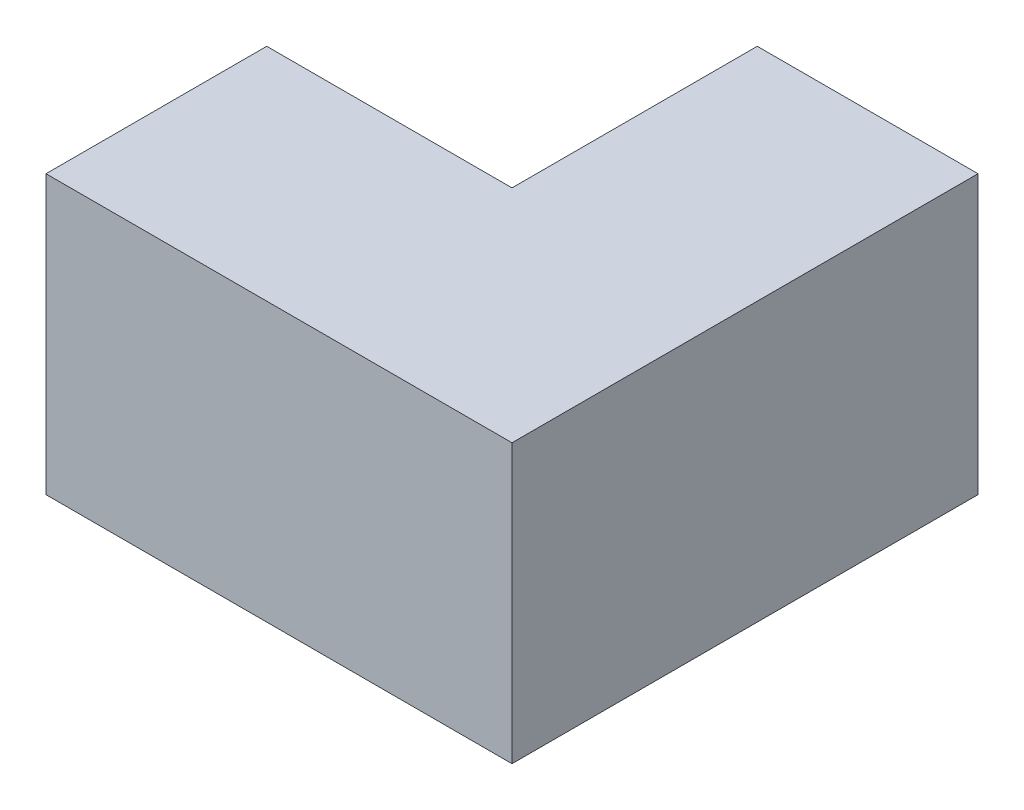
from build123d import *

# Parameters (mm, degrees)
BOSS_EXTRUDE1_DEPTH = 15
SKETCH2_W           = 19.139819484
SKETCH2_H           = 3.3
CUT_EXTRUDE1_DEPTH  = 3
CHAMFER1_SIZE       = 3
BOSS_EXTRUDE2_DEPTH = 2
CUT_EXTRUDE2_DEPTH  = 15
CUT_EXTRUDE3_DEPTH  = 8.5


with BuildPart() as part:
    # Sketch1 → Boss-Extrude1 (new body)
    with BuildSketch(Plane(origin=(0, 0, 0), x_dir=(1, 0, 0), z_dir=(0, 1, 0))):
        Polygon((-5, 8.5), (10, 8.5), (10, 23.5), (23.5, 23.5), (23.5, -5), (-5, -5), align=None)
        Polygon((0, 0), (0, 3.5), (15, 3.5), (15, 18.5), (18.5, 18.5), (18.5, 0), align=None, mode=Mode.SUBTRACT)
    extrude(amount=BOSS_EXTRUDE1_DEPTH)

    # Sketch2 → Cut-Extrude1 (cut)
    with BuildSketch(Plane(origin=(0, 0, -8.5), x_dir=(-1, 0, 0), z_dir=(0, 0, -1))):
        with Locations((-0.430090258, 8.5)):
            Rectangle(SKETCH2_W, SKETCH2_H)
    extrude(amount=-CUT_EXTRUDE1_DEPTH, mode=Mode.SUBTRACT)

    # Chamfer1
    chamfer1_edges = [part.edges().sort_by_distance(p)[0] for p in [
        (2.5, 6.85, -8.5),
        (2.5, 10.15, -8.5),
    ]]
    chamfer(chamfer1_edges, length=CHAMFER1_SIZE - 0.0001)  # a hair under: the kernel refuses the full size

    # Sketch4 → Boss-Extrude2 (add)
    with BuildSketch(Plane(origin=(0, 15, 0), x_dir=(1, 0, 0), z_dir=(0, 1, 0))):
        Polygon((-5, 8.5), (10, 8.5), (10, 23.5), (23.5, 23.5), (23.5, -5), (-5, -5), align=None)
    extrude(amount=BOSS_EXTRUDE2_DEPTH)

    # Sketch5 → Cut-Extrude2 (cut)
    with BuildSketch(Plane.XZ):
        Polygon((0, 0), (-5, 0), (-5, -3.5), (15, -3.5), (15, -24.324803995), (18.5, -24.324803995), (18.5, 0), align=None)
    extrude(amount=-CUT_EXTRUDE2_DEPTH, mode=Mode.SUBTRACT)

    # Sketch6 → Cut-Extrude3 (cut)
    with BuildSketch(Plane.ZY.offset(-10)):
        Polygon((-5.5, 10.15), (-5.5, 6.85), (-8.5, 3.85), (-8.5, 0), (-23.5, 0), (-23.5, 10.15), align=None)
    extrude(amount=-CUT_EXTRUDE3_DEPTH, mode=Mode.SUBTRACT)


solid = part.part
